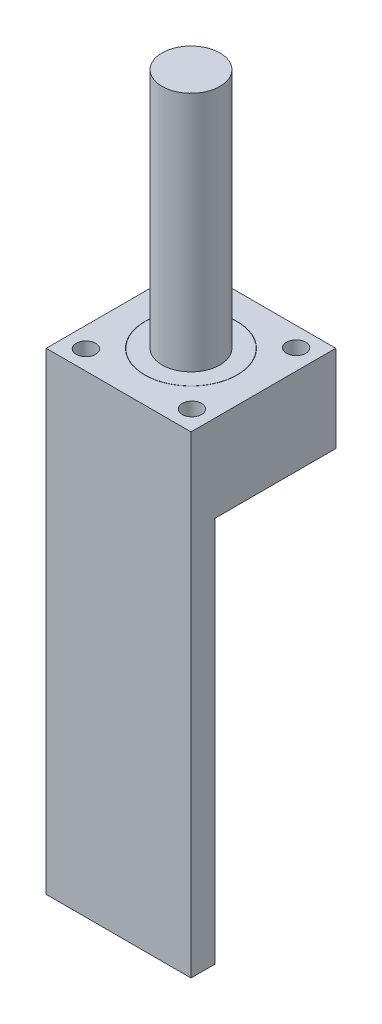
from build123d import *

# Parameters (mm, degrees)
SKETCH1_R                  = 6
BOSS_EXTRUDE1_DEPTH        = 50
BALL_START                 = -10
BALL_BEARING_OUTLINE_W     = 30
BALL_BEARING_OUTLINE_H     = 30
BALL_BEARING_OUTLINE_R     = 2
BALL_BEARING_OUTLINE_R_2   = 9.6
BALL_BEARING_OUTLINE_R_3   = 9.55
BALL_BEARING_OUTLINE_R_4   = 4
BALL_BEARING_DEPTH         = 10
BALL_BEARING_2_OUTLINE_R   = 9.6
BALL_BEARING_2_OUTLINE_R_2 = 9.55
BALL_BEARING_2_OUTLINE_R_3 = 4
BALL_BEARING_2_DEPTH       = 3
SKETCH6_W                  = 30
SKETCH6_H                  = 30
BOSS_EXTRUDE2_DEPTH        = 8
SKETCH7_W                  = 30
SKETCH7_H                  = 5
BOSS_EXTRUDE3_DEPTH        = 80


# Read off the part's stored shape, not the designer's step: ball bearing
with BuildPart() as part:
    # Sketch1 → Boss-Extrude1 (new body)
    with BuildSketch(Plane(origin=(0, 0, 0), x_dir=(1, 0, 0), z_dir=(0, 1, 0))):
        with Locations(Location((0, 0, 0), (0, 0, 270))):
            Circle(SKETCH1_R)
    extrude(amount=BOSS_EXTRUDE1_DEPTH)


with BuildPart() as body_2:
    # ball bearing outline → ball bearing (new body)
    # profile 1 of 2: a face of its own
    with BuildSketch(Plane(origin=(0, 0, 0), x_dir=(1, 0, 0), z_dir=(0, 1, 0)).offset(BALL_START)):
        Rectangle(BALL_BEARING_OUTLINE_W, BALL_BEARING_OUTLINE_H)
        with Locations((-10.792349727, -10.987509758)):
            Circle(BALL_BEARING_OUTLINE_R, mode=Mode.SUBTRACT)
        with Locations((10.987509758, -10.792349727)):
            Circle(BALL_BEARING_OUTLINE_R, mode=Mode.SUBTRACT)
        with Locations((-10.987509758, 10.792349727)):
            Circle(BALL_BEARING_OUTLINE_R, mode=Mode.SUBTRACT)
        Circle(BALL_BEARING_OUTLINE_R_2, mode=Mode.SUBTRACT)
        with Locations((10.792349727, 10.987509758)):
            Circle(BALL_BEARING_OUTLINE_R, mode=Mode.SUBTRACT)
    # profile 2 of 2: a face of its own
    with BuildSketch(Plane(origin=(0, 0, 0), x_dir=(1, 0, 0), z_dir=(0, 1, 0)).offset(BALL_START)):
        Circle(BALL_BEARING_OUTLINE_R_3)
        Circle(BALL_BEARING_OUTLINE_R_4, mode=Mode.SUBTRACT)
    extrude(amount=BALL_BEARING_DEPTH)

    # ball bearing 2 outline → ball bearing 2 (add)
    # profile 1 of 2: a face of its own
    with BuildSketch(Plane(origin=(0, 0, 0), x_dir=(1, 0, 0), z_dir=(0, 1, 0)).offset(BALL_START)):
        Circle(BALL_BEARING_2_OUTLINE_R)
        Circle(BALL_BEARING_2_OUTLINE_R_2, mode=Mode.SUBTRACT)
    # profile 2 of 2: a face of its own
    with BuildSketch(Plane(origin=(0, 0, 0), x_dir=(1, 0, 0), z_dir=(0, 1, 0)).offset(BALL_START)):
        Circle(BALL_BEARING_2_OUTLINE_R_3)
    extrude(amount=BALL_BEARING_2_DEPTH)

    # Sketch6 → Boss-Extrude2 (add)
    with BuildSketch(Plane.XZ.offset(10)):
        Rectangle(SKETCH6_W, SKETCH6_H)
    extrude(amount=BOSS_EXTRUDE2_DEPTH)

    # Sketch7 → Boss-Extrude3 (add)
    with BuildSketch(Plane.XZ.offset(18)):
        with Locations((0, 12.5)):
            Rectangle(SKETCH7_W, SKETCH7_H)
    extrude(amount=BOSS_EXTRUDE3_DEPTH)


solid = Compound([part.part, body_2.part])
